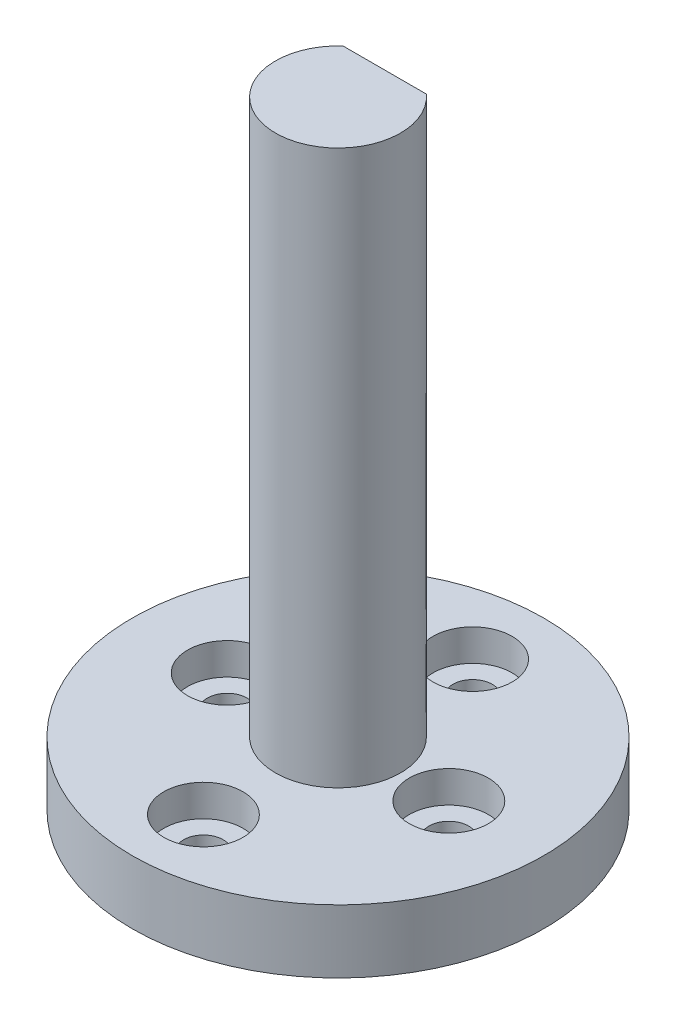
from build123d import *

# Parameters (mm, degrees)
CROQUIS3_R                 = 13
SALIENTE_EXTRUIR1_DEPTH    = 4
CROQUIS4_R                 = 3.95
SALIENTE_EXTRUIR2_DEPTH    = 35
CORTAR_EXTRUIR1_START      = -20
CORTAR_EXTRUIR1_DEPTH      = 20
CORTAR_EXTRUIR3_DEPTH      = 44.116122275
CORTAR_EXTRUIR3_DEPTH_BACK = 44.116122275
CROQUIS8_R                 = 1.25
CORTAR_EXTRUIR5_DEPTH      = 40.534794802
CORTAR_EXTRUIR5_DEPTH_BACK = 2
CROQUIS10_R                = 2.5
CROQUIS10_R_2              = 1.25
CROQUIS9_R                 = 1.625
CORTAR_EXTRUIR4_DEPTH      = 3
CROQUIS11_R                = 4
CORTAR_EXTRUIR6_DEPTH      = 0.5


with BuildPart() as part:
    # Croquis3 → Saliente-Extruir1 (new body)
    with BuildSketch(Plane(origin=(0, 0, 0), x_dir=(1, 0, 0), z_dir=(0, 1, 0))):
        Circle(CROQUIS3_R)
    extrude(amount=SALIENTE_EXTRUIR1_DEPTH)

    # Croquis4 → Saliente-Extruir2 (add)
    with BuildSketch(Plane(origin=(0, 4, 0), x_dir=(1, 0, 0), z_dir=(0, 1, 0))):
        Circle(CROQUIS4_R)
    extrude(amount=SALIENTE_EXTRUIR2_DEPTH)

    # Croquis5 → Cortar-Extruir1 (cut)
    with BuildSketch(Plane(origin=(0, 39, 0), x_dir=(1, 0, 0), z_dir=(0, 1, 0)).offset(CORTAR_EXTRUIR1_START)):
        with BuildLine():
            Line((2.626785107, 2.95), (-2.626785107, 2.95))
            ThreePointArc((-2.626785107, 2.95), (0, 3.95), (2.626785107, 2.95))
        make_face()
    extrude(amount=CORTAR_EXTRUIR1_DEPTH, mode=Mode.SUBTRACT)

    # Croquis8 → Cortar-Extruir3 (cut, two sides: drawn at the far end of the back side and taken through both)
    with BuildSketch(Plane.XZ.offset(-CORTAR_EXTRUIR3_DEPTH_BACK)):
        with Locations((0, 8.5)):
            Circle(CROQUIS8_R)
        with Locations((0, -8.5)):
            Circle(CROQUIS8_R)
        with Locations((-7, 0)):
            Circle(CROQUIS8_R)
        with Locations((7, 0)):
            Circle(CROQUIS8_R)
    extrude(amount=CORTAR_EXTRUIR3_DEPTH + CORTAR_EXTRUIR3_DEPTH_BACK, mode=Mode.SUBTRACT)

    # Croquis10 → Cortar-Extruir5 (cut, two sides: drawn at the far end of the back side and taken through both)
    # profile 1 of 4: a face of its own
    with BuildSketch(Plane(origin=(0, 4, 0), x_dir=(1, 0, 0), z_dir=(0, 1, 0)).offset(-CORTAR_EXTRUIR5_DEPTH_BACK)):
        with Locations((0, 8.5)):
            Circle(CROQUIS10_R)
    # profile 2 of 4: a face of its own
    with BuildSketch(Plane(origin=(0, 4, 0), x_dir=(1, 0, 0), z_dir=(0, 1, 0)).offset(-CORTAR_EXTRUIR5_DEPTH_BACK)):
        with Locations((0, -8.5)):
            Circle(CROQUIS10_R)
    # profile 3 of 4: a face of its own
    with BuildSketch(Plane(origin=(0, 4, 0), x_dir=(1, 0, 0), z_dir=(0, 1, 0)).offset(-CORTAR_EXTRUIR5_DEPTH_BACK)):
        with Locations((-7, 0)):
            Circle(CROQUIS10_R)
        with Locations((-7, 0)):
            Circle(CROQUIS10_R_2, mode=Mode.SUBTRACT)
    # profile 4 of 4: a face of its own
    with BuildSketch(Plane(origin=(0, 4, 0), x_dir=(1, 0, 0), z_dir=(0, 1, 0)).offset(-CORTAR_EXTRUIR5_DEPTH_BACK)):
        with Locations((7, 0)):
            Circle(CROQUIS10_R)
        with Locations((7, 0)):
            Circle(CROQUIS10_R_2, mode=Mode.SUBTRACT)
    extrude(amount=CORTAR_EXTRUIR5_DEPTH + CORTAR_EXTRUIR5_DEPTH_BACK, mode=Mode.SUBTRACT)

    # Croquis9 → Cortar-Extruir4 (cut)
    with BuildSketch(Plane(origin=(0, 0, 0), x_dir=(1, 0, 0), z_dir=(0, 1, 0))):
        Circle(CROQUIS9_R)
    extrude(amount=CORTAR_EXTRUIR4_DEPTH, mode=Mode.SUBTRACT)

    # Croquis11 → Cortar-Extruir6 (cut)
    with BuildSketch(Plane.XZ):
        Circle(CROQUIS11_R)
    extrude(amount=-CORTAR_EXTRUIR6_DEPTH, mode=Mode.SUBTRACT)


solid = part.part
